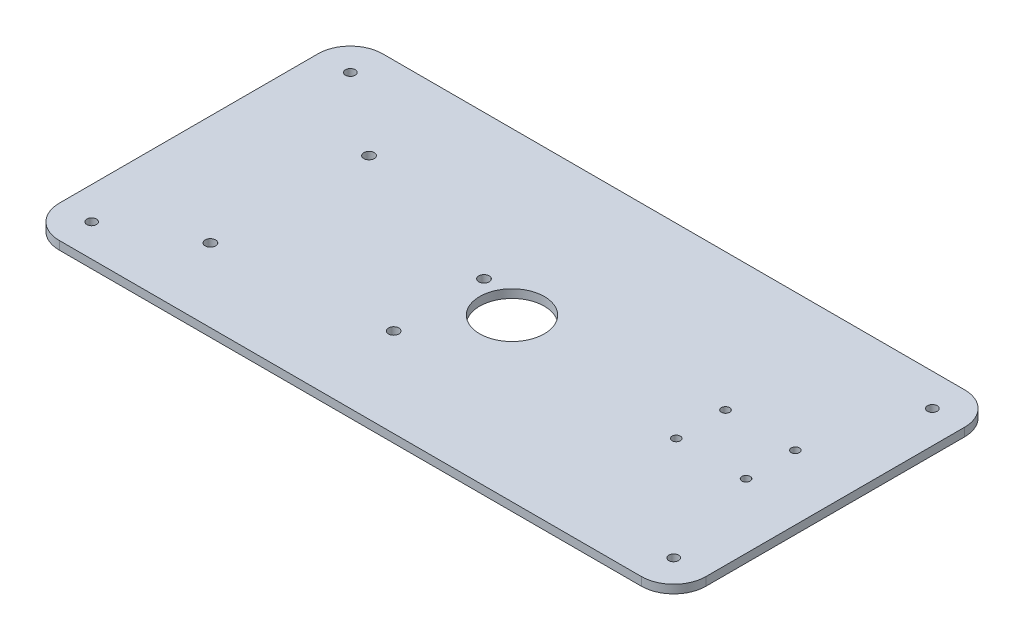
from build123d import *

# Parameters (mm, degrees)
SKETCH1_W               = 200
SKETCH1_H               = 100
BOSS_EXTRUDE1_DEPTH     = 2.6
FILLET1_R               = 10
SKETCH6_R               = 1.5
CUT_EXTRUDE6_DEPTH      = 2.6
MIRROR6_COPY_1_SKETCH_R = 1.5
MIRROR6_COPY_1_DEPTH    = 2.6
MIRROR6_COPY_2_SKETCH_R = 1.5
MIRROR6_COPY_2_DEPTH    = 2.6
SKETCH16_R              = 1.61925
CUT_EXTRUDE9_DEPTH      = 10
SKETCH17_R              = 1.61925
CUT_EXTRUDE10_DEPTH     = 224.621913059
SKETCH18_R              = 1.61925
CUT_EXTRUDE11_DEPTH     = 224.621913059
SKETCH19_R              = 1.61925
CUT_EXTRUDE12_DEPTH     = 224.621913059
SKETCH15_R              = 10
CUT_EXTRUDE14_DEPTH     = 224.621913059
SKETCH20_R              = 1.27
CUT_EXTRUDE15_DEPTH     = 224.621913059


with BuildPart() as part:
    # Sketch1 → Boss-Extrude1 (new body)
    with BuildSketch(Plane(origin=(0, 0, 0), x_dir=(1, 0, 0), z_dir=(0, 1, 0))):
        with Locations((100, -50)):
            Rectangle(SKETCH1_W, SKETCH1_H)
    extrude(amount=BOSS_EXTRUDE1_DEPTH)

    # Fillet1
    fillet1_edges = [part.edges().sort_by_distance(p)[0] for p in [
        (0, 1.3, 0),
        (0, 1.3, 100),
        (200, 1.3, 100),
        (200, 1.3, 0),
    ]]
    fillet(fillet1_edges, radius=FILLET1_R)

    # Sketch6 → Cut-Extrude6 (cut)
    with BuildSketch(Plane.XZ):
        with Locations((190, 10)):
            Circle(SKETCH6_R)
    cut_extrude6 = extrude(amount=-CUT_EXTRUDE6_DEPTH, mode=Mode.SUBTRACT)

    # Mirror5: Cut-Extrude6 across plane
    add(cut_extrude6.mirror(Plane(origin=(100, 0, 0), x_dir=(0, 0, 1), z_dir=(1, 0, 0))), mode=Mode.SUBTRACT)

    # Mirror6 copy 1 sketch → Mirror6 copy 1 (cut)
    with BuildSketch(Plane(origin=(200, 0, 100), x_dir=(-1, 0, 0), z_dir=(0, -1, 0))):
        with Locations((190, 10)):
            Circle(MIRROR6_COPY_1_SKETCH_R)
    extrude(amount=-MIRROR6_COPY_1_DEPTH, mode=Mode.SUBTRACT)

    # Mirror6 copy 2 sketch → Mirror6 copy 2 (cut)
    with BuildSketch(Plane(origin=(0, 0, 100), x_dir=(1, 0, 0), z_dir=(0, -1, 0))):
        with Locations((190, -10)):
            Circle(MIRROR6_COPY_2_SKETCH_R)
    extrude(amount=-MIRROR6_COPY_2_DEPTH, mode=Mode.SUBTRACT)

    # Sketch16 → Cut-Extrude9 (cut)
    with BuildSketch(Plane(origin=(0, 2.6, 0), x_dir=(1, 0, 0), z_dir=(0, 1, 0))):
        with Locations((35.15745, -29.37145)):
            Circle(SKETCH16_R)
    extrude(amount=-CUT_EXTRUDE9_DEPTH, mode=Mode.SUBTRACT)

    # Sketch17 → Cut-Extrude10 (cut, through all)
    with BuildSketch(Plane(origin=(0, 2.6, 0), x_dir=(1, 0, 0), z_dir=(0, 1, 0))):
        with Locations((85.94475, -44.61145)):
            Circle(SKETCH17_R)
    extrude(amount=-CUT_EXTRUDE10_DEPTH, mode=Mode.SUBTRACT)

    # Sketch18 → Cut-Extrude11 (cut, through all)
    with BuildSketch(Plane(origin=(0, 2.6, 0), x_dir=(1, 0, 0), z_dir=(0, 1, 0))):
        with Locations((34.01445, -77.28855)):
            Circle(SKETCH18_R)
    extrude(amount=-CUT_EXTRUDE11_DEPTH, mode=Mode.SUBTRACT)

    # Sketch19 → Cut-Extrude12 (cut, through all)
    with BuildSketch(Plane(origin=(0, 2.6, 0), x_dir=(1, 0, 0), z_dir=(0, 1, 0))):
        with Locations((85.94475, -72.53875)):
            Circle(SKETCH19_R)
    extrude(amount=-CUT_EXTRUDE12_DEPTH, mode=Mode.SUBTRACT)

    # Sketch15 → Cut-Extrude14 (cut, through all)
    with BuildSketch(Plane.XZ):
        with Locations((100, 50)):
            Circle(SKETCH15_R)
    extrude(amount=-CUT_EXTRUDE14_DEPTH, mode=Mode.SUBTRACT)

    # Sketch20 → Cut-Extrude15 (cut, through all)
    with BuildSketch(Plane(origin=(0, 2.6, 0), x_dir=(1, 0, 0), z_dir=(0, 1, 0))):
        with Locations((158.41, -42.38)):
            Circle(SKETCH20_R)
        with Locations((180, -42.38)):
            Circle(SKETCH20_R)
        with Locations((158.41, -57.62)):
            Circle(SKETCH20_R)
        with Locations((180, -57.62)):
            Circle(SKETCH20_R)
    extrude(amount=-CUT_EXTRUDE15_DEPTH, mode=Mode.SUBTRACT)


solid = part.part
